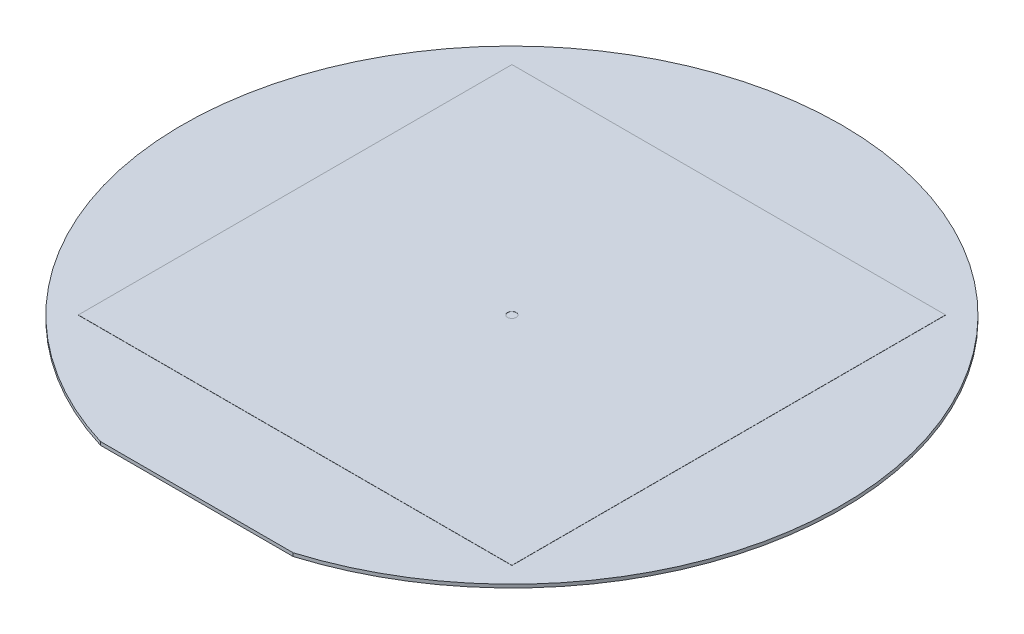
from build123d import *

# Parameters (mm, degrees)
SKETCH1_W           = 50
SKETCH1_H           = 50
SKETCH1_R           = 0.5
BOSS_EXTRUDE1_DEPTH = 0.4
BOSS_EXTRUDE2_DEPTH = 0.381


with BuildPart() as part:
    # Sketch1 → Boss-Extrude1 (new body)
    with BuildSketch(Plane(origin=(0, 0, 0), x_dir=(1, 0, 0), z_dir=(0, 1, 0))):
        Rectangle(SKETCH1_W, SKETCH1_H)
        Circle(SKETCH1_R, mode=Mode.SUBTRACT)
    extrude(amount=BOSS_EXTRUDE1_DEPTH)

    # Sketch3 → Boss-Extrude2 (add)
    with BuildSketch(Plane(origin=(0, 0, 0), x_dir=(1, 0, 0), z_dir=(0, 1, 0))):
        with BuildLine():
            ThreePointArc((38, 0), (-22.60331834, 30.546521897), (-11.11, -36.339618875))
            Line((-11.11, -36.339618875), (11.11, -36.339618875))
            ThreePointArc((11.11, -36.339618875), (30.546521897, -22.60331834), (38, 0))
        make_face()
    extrude(amount=BOSS_EXTRUDE2_DEPTH)


solid = part.part
